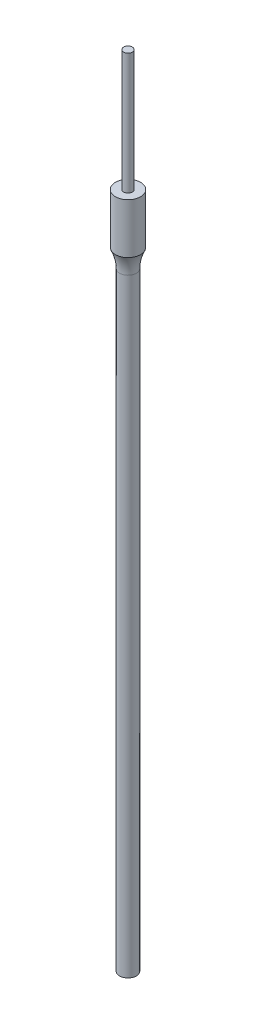
from build123d import *

# Parameters (mm, degrees)
SKETCH1_R           = 2
BOSS_EXTRUDE1_DEPTH = 150
SKETCH2_R           = 3
BOSS_EXTRUDE2_DEPTH = 12
FILLET1_R           = 10
SKETCH3_R           = 1.048302248
BOSS_EXTRUDE3_DEPTH = 29


with BuildPart() as part:
    # Sketch1 → Boss-Extrude1 (new body)
    with BuildSketch(Plane(origin=(0, 0, 0), x_dir=(1, 0, 0), z_dir=(0, 1, 0))):
        with Locations(Location((0, 0, 0), (0, 0, 270))):
            Circle(SKETCH1_R)
    extrude(amount=BOSS_EXTRUDE1_DEPTH)

    # Sketch2 → Boss-Extrude2 (add)
    with BuildSketch(Plane(origin=(0, 150, 0), x_dir=(1, 0, 0), z_dir=(0, 1, 0))):
        with Locations(Location((0, 0, 0), (0, 0, 270))):
            Circle(SKETCH2_R)
    extrude(amount=BOSS_EXTRUDE2_DEPTH)

    # Fillet1
    # the kernel refuses this fillet: 10 mm, written as the material it adds along each edge
    with BuildSketch(Plane(origin=(0, 150, 0), x_dir=(0, 0, 1), z_dir=(-1, 0, 0))) as fillet1_piece_1:
        with BuildLine():
            CenterArc((12, -4.358898944), FILLET1_R, 154.158067237, 25.841932763)
            Line((2, -4.358898944), (1.8, -4.358898944))
            Line((1.8, -4.358898944), (1.8, 0))
            Line((1.8, 0), (2, 0.2))
            ThreePointArc((2, 0.2), (2.5, 0.2), (2.82, 0.087177979))
            Line((2.82, 0.087177979), (3, 0))
        make_face()
    revolve(axis=Axis((0, 150, 0), (0, 1, 0)))


with BuildPart() as body_2:
    # Sketch3 → Boss-Extrude3 (new body)
    with BuildSketch(Plane(origin=(0, 162, 0), x_dir=(1, 0, 0), z_dir=(0, 1, 0))):
        with Locations(Location((0, 0, 0), (0, 0, 270))):
            Circle(SKETCH3_R)
    extrude(amount=BOSS_EXTRUDE3_DEPTH)


solid = Compound([part.part, body_2.part])
